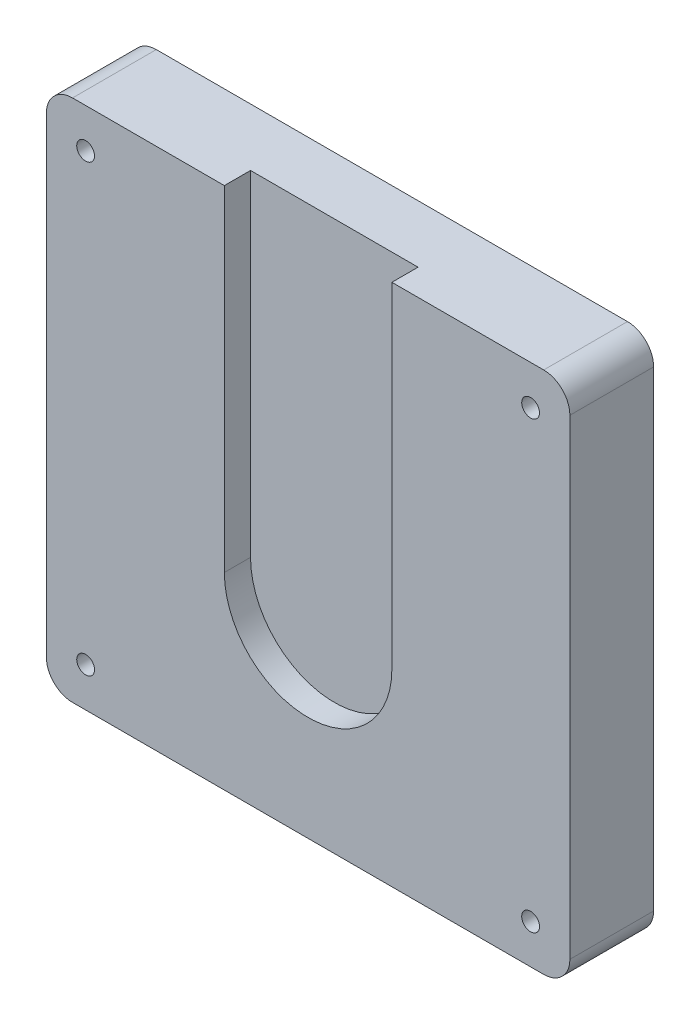
from build123d import *

# Parameters (mm, degrees)
SKETCH1_W                                    = 100
SKETCH1_H                                    = 100
BOSS_EXTRUDE1_DEPTH                          = 16
SKETCH2_W                                    = 100
SKETCH2_H                                    = 100
BOSS_EXTRUDE2_DEPTH                          = 16
CUT_EXTRUDE1_DEPTH                           = 80
BOSS_EXTRUDE3_DEPTH                          = 16
BOSS_EXTRUDE4_REACH                          = 75.763
CSK_FOR_M3_COUNTERSUNK_FLAT_HEAD_SCR_2_COUNT = 2
CSK_FOR_M3_COUNTERSUNK_FLAT_HEAD_SCR_2_PITCH = 85
CSK_FOR_M3_COUNTERSUNK_FLAT_HEAD_SCR_3_COUNT = 2
CSK_FOR_M3_COUNTERSUNK_FLAT_HEAD_SCR_3_PITCH = 120.208152802
CSK_FOR_M3_COUNTERSUNK_FLAT_HEAD_SCR_4_COUNT = 2
CSK_FOR_M3_COUNTERSUNK_FLAT_HEAD_SCR_4_PITCH = 85
FILLET1_R                                    = 5
FILLET2_R                                    = 5


with BuildPart() as part:
    # Sketch1 → Boss-Extrude1 (new body)
    with BuildSketch(Plane.XY):
        Rectangle(SKETCH1_W, SKETCH1_H)
    extrude(amount=BOSS_EXTRUDE1_DEPTH)


with BuildPart() as body_2:
    # Sketch2 → Boss-Extrude2 (new body)
    with BuildSketch(Plane.XY.offset(16)):
        Rectangle(SKETCH2_W, SKETCH2_H)
    extrude(amount=BOSS_EXTRUDE2_DEPTH)


with BuildPart() as cut_extrude1_tool:
    # Sketch3 → Cut-Extrude1 (new body)
    with BuildSketch(Plane(origin=(0, 50, 0), x_dir=(1, 0, 0), z_dir=(0, 1, 0))):
        Polygon((-16, -32), (-16, -28.5), (-10, -28.5), (-10, -16), (-16, -16), (-16, -11), (16, -11), (16, -16), (10, -16), (10, -28.5), (16, -28.5), (16, -32), align=None)
    extrude(amount=-CUT_EXTRUDE1_DEPTH)


with BuildPart() as part_1:
    add(part.part)

    # Cut-Extrude1: cut by cut_extrude1_tool
    add(cut_extrude1_tool.part, mode=Mode.SUBTRACT)



with BuildPart() as body_2_1:
    add(body_2.part)

    # Cut-Extrude1: cut by cut_extrude1_tool
    add(cut_extrude1_tool.part, mode=Mode.SUBTRACT)

    # Sketch4 → Boss-Extrude3 (add)
    with BuildSketch(Plane.XY.offset(32)):
        with BuildLine():
            Line((-16, -14), (-16, -30))
            Line((-16, -30), (0, -30))
            ThreePointArc((0, -30), (-11.313708499, -25.313708499), (-16, -14))
        make_face()
        with BuildLine():
            ThreePointArc((16, -14), (11.313708499, -25.313708499), (0, -30))
            Line((0, -30), (16, -30))
            Line((16, -30), (16, -14))
        make_face()
    extrude(amount=-BOSS_EXTRUDE3_DEPTH)


with BuildPart() as part_2:
    add(part_1.part)

    # Sketch5 → Boss-Extrude4 (add, up to next)
    with BuildSketch(Plane.XY.offset(11), mode=Mode.PRIVATE) as boss_extrude4_sk1:
        with BuildLine():
            Line((16, -30), (16, -14))
            ThreePointArc((16, -14), (11.313708487, -25.313708511), (-3.4e-08, -30))
            Line((-3.4e-08, -30), (16, -30))
        make_face()
    boss_extrude4_tool1 = extrude(boss_extrude4_sk1.sketch, amount=BOSS_EXTRUDE4_REACH, mode=Mode.PRIVATE) - body_2_1.part
    # Sketch5 → Boss-Extrude4 (add, up to next)
    with BuildSketch(Plane.XY.offset(11), mode=Mode.PRIVATE) as boss_extrude4_sk2:
        with BuildLine():
            ThreePointArc((-3.4e-08, -30), (-11.313708511, -25.313708487), (-16, -14))
            Line((-16, -14), (-16, -30))
            Line((-16, -30), (-3.4e-08, -30))
        make_face()
    boss_extrude4_tool2 = extrude(boss_extrude4_sk2.sketch, amount=BOSS_EXTRUDE4_REACH, mode=Mode.PRIVATE) - body_2_1.part
    add(boss_extrude4_tool1.solids().sort_by_distance((12.426113, -26.426113, 11))[0])
    add(boss_extrude4_tool2.solids().sort_by_distance((-12.426113, -26.426113, 11))[0])


with BuildPart() as csk_for_m3_countersunk_flat_head_screw1_tool:
    # Sketch7 → CSK for M3 Countersunk Flat Head Screw1 (revolve)
    with BuildSketch(Plane(origin=(-42.5, 42.5, 32), x_dir=(0, -1, 0), z_dir=(1, 0, 0))):
        Polygon((0, 0), (0, 32), (1.7, 32), (1.7, 1.45), (3.15, 0), align=None)
    csk_for_m3_countersunk_flat_head_screw1 = revolve(axis=Axis((-42.5, 42.5, 38.35), (0, 0, -1)))


with BuildPart() as part_3:
    add(part_2.part)

    # CSK for M3 Countersunk Flat Head Screw1: cut by csk_for_m3_countersunk_flat_head_screw1_tool
    add(csk_for_m3_countersunk_flat_head_screw1_tool.part, mode=Mode.SUBTRACT)


with BuildPart() as body_2_2:
    add(body_2_1.part)

    # CSK for M3 Countersunk Flat Head Screw1: cut by csk_for_m3_countersunk_flat_head_screw1_tool
    add(csk_for_m3_countersunk_flat_head_screw1_tool.part, mode=Mode.SUBTRACT)


with BuildPart() as csk_for_m3_countersunk_flat_head_scr_2_tool:
    # CSK for M3 Countersunk Flat Head Scr 2: CSK for M3 Countersunk Flat Head Screw1 ×2
    with Locations(*[(i * CSK_FOR_M3_COUNTERSUNK_FLAT_HEAD_SCR_2_PITCH, 0, 0) for i in range(1, CSK_FOR_M3_COUNTERSUNK_FLAT_HEAD_SCR_2_COUNT)]):
        add(csk_for_m3_countersunk_flat_head_screw1)


with BuildPart() as part_4:
    add(part_3.part)

    # CSK for M3 Countersunk Flat Head Scr 2: cut by csk_for_m3_countersunk_flat_head_scr_2_tool
    add(csk_for_m3_countersunk_flat_head_scr_2_tool.part, mode=Mode.SUBTRACT)


with BuildPart() as body_2_3:
    add(body_2_2.part)

    # CSK for M3 Countersunk Flat Head Scr 2: cut by csk_for_m3_countersunk_flat_head_scr_2_tool
    add(csk_for_m3_countersunk_flat_head_scr_2_tool.part, mode=Mode.SUBTRACT)


with BuildPart() as csk_for_m3_countersunk_flat_head_scr_3_tool:
    # CSK for M3 Countersunk Flat Head Scr 3: CSK for M3 Countersunk Flat Head Screw1 ×2
    with Locations(*[Vector(0.7071067811865476, -0.7071067811865476, 0) * (i * CSK_FOR_M3_COUNTERSUNK_FLAT_HEAD_SCR_3_PITCH) for i in range(1, CSK_FOR_M3_COUNTERSUNK_FLAT_HEAD_SCR_3_COUNT)]):
        add(csk_for_m3_countersunk_flat_head_screw1)


with BuildPart() as part_5:
    add(part_4.part)

    # CSK for M3 Countersunk Flat Head Scr 3: cut by csk_for_m3_countersunk_flat_head_scr_3_tool
    add(csk_for_m3_countersunk_flat_head_scr_3_tool.part, mode=Mode.SUBTRACT)


with BuildPart() as body_2_4:
    add(body_2_3.part)

    # CSK for M3 Countersunk Flat Head Scr 3: cut by csk_for_m3_countersunk_flat_head_scr_3_tool
    add(csk_for_m3_countersunk_flat_head_scr_3_tool.part, mode=Mode.SUBTRACT)


with BuildPart() as csk_for_m3_countersunk_flat_head_scr_4_tool:
    # CSK for M3 Countersunk Flat Head Scr 4: CSK for M3 Countersunk Flat Head Screw1 ×2
    with Locations(*[(0, -i * CSK_FOR_M3_COUNTERSUNK_FLAT_HEAD_SCR_4_PITCH, 0) for i in range(1, CSK_FOR_M3_COUNTERSUNK_FLAT_HEAD_SCR_4_COUNT)]):
        add(csk_for_m3_countersunk_flat_head_screw1)


with BuildPart() as part_6:
    add(part_5.part)

    # CSK for M3 Countersunk Flat Head Scr 4: cut by csk_for_m3_countersunk_flat_head_scr_4_tool
    add(csk_for_m3_countersunk_flat_head_scr_4_tool.part, mode=Mode.SUBTRACT)

    # Fillet2
    fillet2_edges = [part_6.edges().sort_by_distance(p)[0] for p in [
        (50, -50, 8),
        (50, 50, 8),
        (-50, 50, 8),
        (-50, -50, 8),
    ]]
    fillet(fillet2_edges, radius=FILLET2_R)


with BuildPart() as body_2_5:
    add(body_2_4.part)

    # CSK for M3 Countersunk Flat Head Scr 4: cut by csk_for_m3_countersunk_flat_head_scr_4_tool
    add(csk_for_m3_countersunk_flat_head_scr_4_tool.part, mode=Mode.SUBTRACT)

    # Fillet1
    fillet1_edges = [body_2_5.edges().sort_by_distance(p)[0] for p in [
        (-50, -50, 24),
        (50, -50, 24),
        (50, 50, 24),
        (-50, 50, 24),
    ]]
    fillet(fillet1_edges, radius=FILLET1_R)


solid = part_6.part
